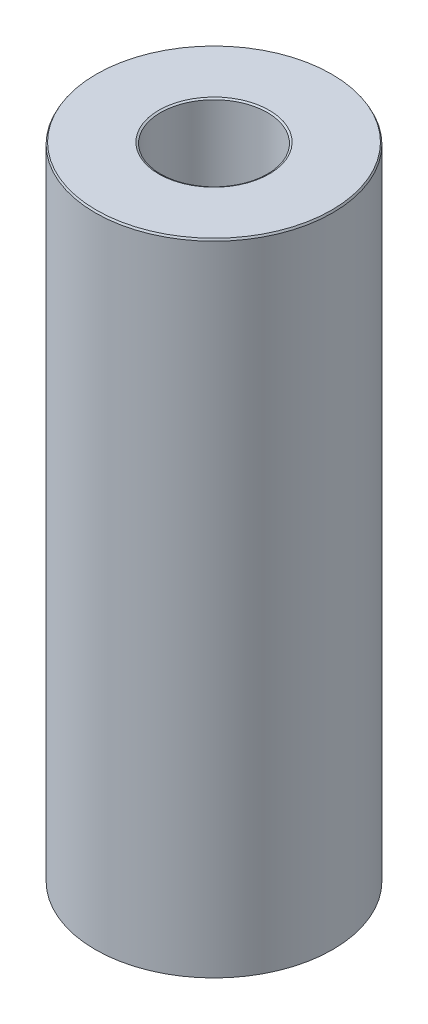
from build123d import *
from OCP.BRepFilletAPI import BRepFilletAPI_MakeChamfer

# Parameters (mm, degrees)
SKETCH1_R           = 30
BOSS_EXTRUDE1_DEPTH = 161.933538742
SKETCH2_R           = 13.486856102
CUT_EXTRUDE1_DEPTH  = 168.399136705
CHAMFER1_SIZE       = 0.47260097
CHAMFER1_SIZE2      = 0.259017485


with BuildPart() as part:
    # Sketch1 → Boss-Extrude1 (new body)
    with BuildSketch(Plane(origin=(0, 0, 0), x_dir=(1, 0, 0), z_dir=(0, 1, 0))):
        Circle(SKETCH1_R)
    extrude(amount=BOSS_EXTRUDE1_DEPTH)

    # Sketch2 → Cut-Extrude1 (cut, through all)
    with BuildSketch(Plane(origin=(0, 0, 0), x_dir=(1, 0, 0), z_dir=(0, 1, 0))):
        Circle(SKETCH2_R)
    extrude(amount=CUT_EXTRUDE1_DEPTH, mode=Mode.SUBTRACT)

    # Chamfer1: one chamfer whose edges measure the first distance from different faces: ONE call of the kernel's chamfer builder (chamfer() names one face for all edges)
    chamfer1_edges_1 = [part.edges().sort_by_distance(p)[0] for p in [
        (-13.486856102, 161.933538742, 0),
    ]]
    chamfer1_side_1 = [part.faces().sort_by_distance(p)[0] for p in [
        (-29.151471863, 161.933538742, 0),
    ]]
    chamfer1_edges_2 = [part.edges().sort_by_distance(p)[0] for p in [
        (-13.486856102, 0, 0),
    ]]
    chamfer1_side_2 = [part.faces().sort_by_distance(p)[0] for p in [
        (-13.486856102, 80.966769371, 0),
    ]]
    chamfer1_edges_3 = [part.edges().sort_by_distance(p)[0] for p in [
        (-30, 0, 0),
    ]]
    chamfer1_side_3 = [part.faces().sort_by_distance(p)[0] for p in [
        (-29.151471863, 0, 0),
    ]]
    chamfer1_edges_4 = [part.edges().sort_by_distance(p)[0] for p in [
        (-30, 161.933538742, 0),
    ]]
    chamfer1_side_4 = [part.faces().sort_by_distance(p)[0] for p in [
        (-30, 80.966769371, 0),
    ]]
    chamfer1 = BRepFilletAPI_MakeChamfer(part.part.solid().wrapped)
    for e in chamfer1_edges_1:
        chamfer1.Add(CHAMFER1_SIZE, CHAMFER1_SIZE2, e.wrapped, chamfer1_side_1[0].wrapped)  # the first distance lies on this face
    for e in chamfer1_edges_2:
        chamfer1.Add(CHAMFER1_SIZE, CHAMFER1_SIZE2, e.wrapped, chamfer1_side_2[0].wrapped)  # the first distance lies on this face
    for e in chamfer1_edges_3:
        chamfer1.Add(CHAMFER1_SIZE, CHAMFER1_SIZE2, e.wrapped, chamfer1_side_3[0].wrapped)  # the first distance lies on this face
    for e in chamfer1_edges_4:
        chamfer1.Add(CHAMFER1_SIZE, CHAMFER1_SIZE2, e.wrapped, chamfer1_side_4[0].wrapped)  # the first distance lies on this face
    add(Compound.cast(chamfer1.Shape()), mode=Mode.REPLACE)


solid = part.part
